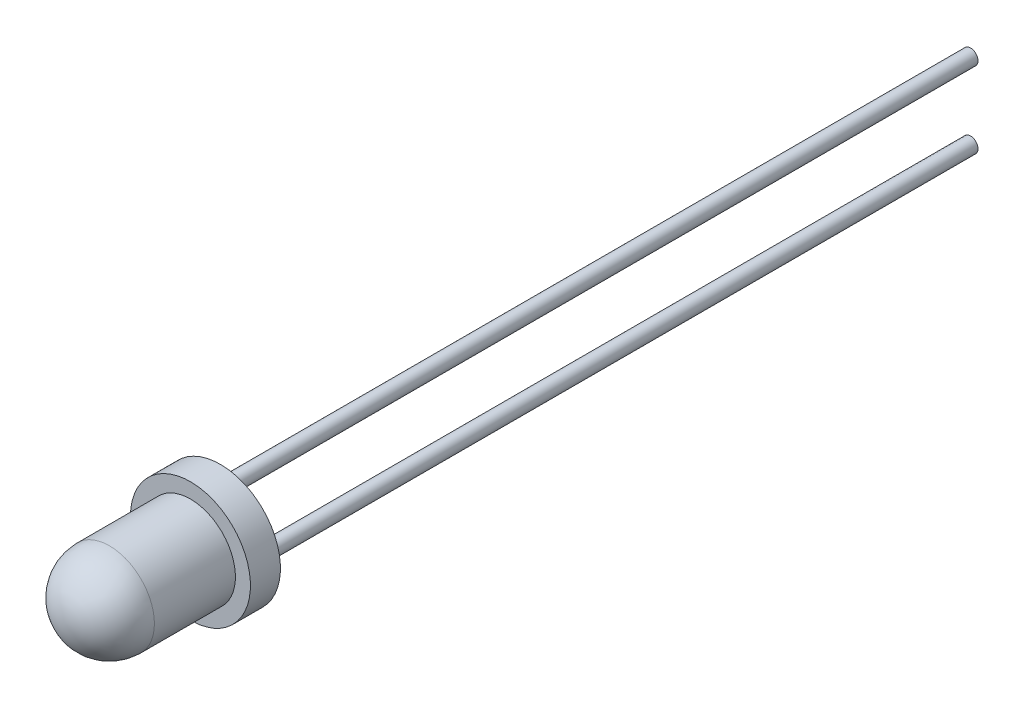
from build123d import *

# Parameters (mm, degrees)
SKETCH_1_R           = 1.5
EXTRUDE_1_DEPTH      = 4.2
FILLET_1_R           = 1.5
SKETCH_2_R           = 2
EXTRUDE_2_DEPTH      = 1
EXTRUDE_START        = 0.5
SKETCH_3_R           = 1.5
EXTRUDE_3_DEPTH      = 0.5
CHAMFER_1_SIZE       = 0.5
EXTRUDE_4_DEPTH      = 24.5
EXTRUDE_4_DEPTH_BACK = 0.5
SKETCH_4_R           = 0.25


with BuildPart() as part:
    # Эскиз1 → Бобышка-Вытянуть1 (new body)
    with BuildSketch(Plane.XY):
        Circle(SKETCH_1_R)
    extrude(amount=EXTRUDE_1_DEPTH)

    # Скругление1
    fillet_1_edges = [part.edges().sort_by_distance(p)[0] for p in [
        (-1.5, 0, 4.2),
    ]]
    fillet(fillet_1_edges, radius=FILLET_1_R)

    # Эскиз2 → Бобышка-Вытянуть2 (add)
    with BuildSketch(Plane(origin=(0, 0, 0), x_dir=(-1, 0, 0), z_dir=(0, 0, -1))):
        Circle(SKETCH_2_R)
    extrude(amount=EXTRUDE_2_DEPTH)

    # Эскиз3 → Бобышка-Вытянуть3 (add)
    with BuildSketch(Plane(origin=(0, 0, -1), x_dir=(-1, 0, 0), z_dir=(0, 0, -1)).offset(EXTRUDE_START)):
        Circle(SKETCH_3_R)
    extrude(amount=-EXTRUDE_3_DEPTH)

    # Фаска1
    chamfer_1_edges = [part.edges().sort_by_distance(p)[0] for p in [
        (1.5, 0, -1.5),
    ]]
    chamfer(chamfer_1_edges, length=CHAMFER_1_SIZE - 0.0001)  # a hair under: the kernel refuses the full size

    # Эскиз4 → Бобышка-Вытянуть4 (add, two sides: drawn at the far end of the back side and taken through both)
    with BuildSketch(Plane(origin=(0, 0, -1.5), x_dir=(-1, 0, 0), z_dir=(0, 0, -1)).offset(-EXTRUDE_4_DEPTH_BACK)):
        with Locations((0, 1.27)):
            Circle(SKETCH_4_R)
        with Locations((0, -1.27)):
            Circle(SKETCH_4_R)
    extrude(amount=EXTRUDE_4_DEPTH + EXTRUDE_4_DEPTH_BACK)


solid = part.part
